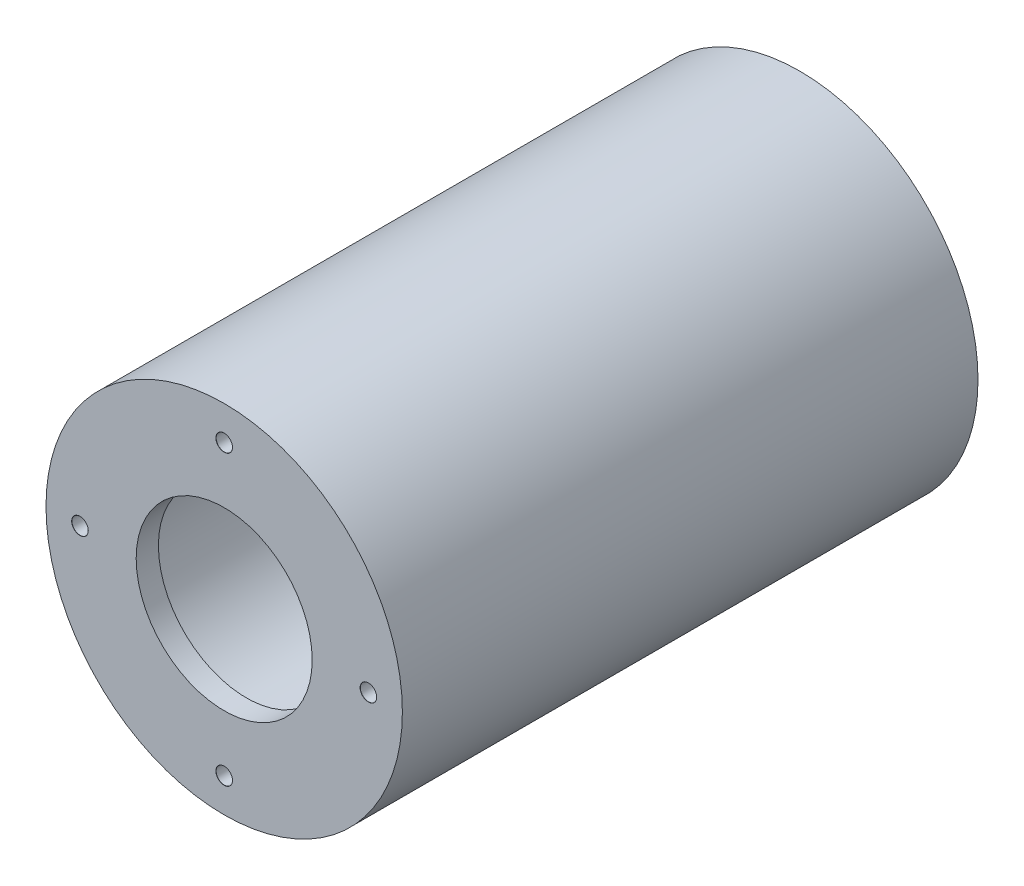
from build123d import *

# Parameters (mm, degrees)
TAP_DRILL_FOR_M4X0_7_TAP1_AT_2_COUNT = 2
TAP_DRILL_FOR_M4X0_7_TAP1_AT_2_PITCH = 41.205783037
TAP_DRILL_FOR_M4X0_7_TAP1_AT_3_COUNT = 2
TAP_DRILL_FOR_M4X0_7_TAP1_AT_3_PITCH = 58.273777218
TAP_DRILL_FOR_M4X0_7_TAP1_AT_4_COUNT = 2
TAP_DRILL_FOR_M4X0_7_TAP1_AT_4_PITCH = 41.205783037


with BuildPart() as part:
    # Sketch1 → Revolve1 (revolve)
    with BuildSketch(Plane(origin=(0, 0, 0), x_dir=(0, 0, -1), z_dir=(1, 0, 0))):
        Polygon((-25.2, 22.500015), (-25.2, 36), (-141.5, 36), (-141.5, 17.78), (-137.008, 17.78), (-137.008, 22.500015), align=None)
    revolve(axis=Axis((0, 0, 141.5), (0, 0, -1)))

    # Sketch6 → Tap Drill for M4x0.7 Tap1 (revolve, cut)
    with BuildSketch(Plane(origin=(0, 29.136888609, 25.2), x_dir=(0, 1, 0), z_dir=(1, 0, 0))):
        Polygon((0, 0), (0, 10.991420021), (1.65, 10), (1.65, 0.025), (1.675, 0), align=None)
    tap_drill_for_m4x0_7_tap1 = revolve(axis=Axis((0, 29.136888609, 18.85), (0, 0, 1)), mode=Mode.SUBTRACT)

    # Tap Drill for M4x0.7 Tap1 at 2: Tap Drill for M4x0.7 Tap1 ×2
    with Locations(*[Vector(-0.7071067811865476, -0.7071067811865476, 0) * (i * TAP_DRILL_FOR_M4X0_7_TAP1_AT_2_PITCH) for i in range(1, TAP_DRILL_FOR_M4X0_7_TAP1_AT_2_COUNT)]):
        add(tap_drill_for_m4x0_7_tap1, mode=Mode.SUBTRACT)

    # Tap Drill for M4x0.7 Tap1 at 3: Tap Drill for M4x0.7 Tap1 ×2
    with Locations(*[(0, -i * TAP_DRILL_FOR_M4X0_7_TAP1_AT_3_PITCH, 0) for i in range(1, TAP_DRILL_FOR_M4X0_7_TAP1_AT_3_COUNT)]):
        add(tap_drill_for_m4x0_7_tap1, mode=Mode.SUBTRACT)

    # Tap Drill for M4x0.7 Tap1 at 4: Tap Drill for M4x0.7 Tap1 ×2
    with Locations(*[Vector(0.7071067811865476, -0.7071067811865476, 0) * (i * TAP_DRILL_FOR_M4X0_7_TAP1_AT_4_PITCH) for i in range(1, TAP_DRILL_FOR_M4X0_7_TAP1_AT_4_COUNT)]):
        add(tap_drill_for_m4x0_7_tap1, mode=Mode.SUBTRACT)

    # Mirror1: Tap Drill for M4x0.7 Tap1 across plane
    add(tap_drill_for_m4x0_7_tap1.mirror(Plane(origin=(0, 0, 83.35), x_dir=(1, 0, 0), z_dir=(0, 0, -1))), mode=Mode.SUBTRACT)

    # Mirror1 copy 1 sketch → Mirror1 copy 1 (revolve, cut)
    with BuildSketch(Plane(origin=(-29.136888609, 0, 141.5), x_dir=(0, 1, 0), z_dir=(1, 0, 0))):
        Polygon((0, 0), (0, -10.991420021), (1.65, -10), (1.65, -0.025), (1.675, 0), align=None)
    revolve(axis=Axis((-29.136888609, 0, 147.85), (0, 0, 1)), mode=Mode.SUBTRACT)

    # Mirror1 copy 2 sketch → Mirror1 copy 2 (revolve, cut)
    with BuildSketch(Plane(origin=(0, -29.136888609, 141.5), x_dir=(0, 1, 0), z_dir=(1, 0, 0))):
        Polygon((0, 0), (0, -10.991420021), (1.65, -10), (1.65, -0.025), (1.675, 0), align=None)
    revolve(axis=Axis((0, -29.136888609, 147.85), (0, 0, 1)), mode=Mode.SUBTRACT)

    # Mirror1 copy 3 sketch → Mirror1 copy 3 (revolve, cut)
    with BuildSketch(Plane(origin=(29.136888609, 0, 141.5), x_dir=(0, 1, 0), z_dir=(1, 0, 0))):
        Polygon((0, 0), (0, -10.991420021), (1.65, -10), (1.65, -0.025), (1.675, 0), align=None)
    revolve(axis=Axis((29.136888609, 0, 147.85), (0, 0, 1)), mode=Mode.SUBTRACT)


solid = part.part
